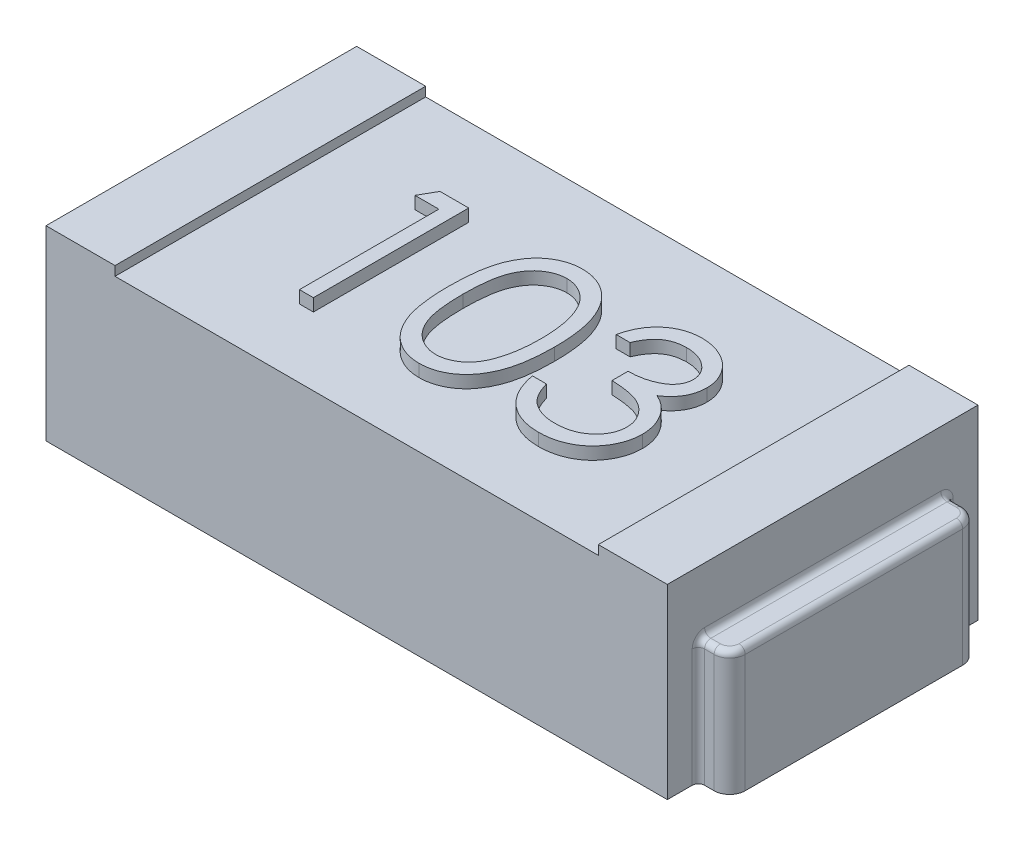
from build123d import *

# Parameters (mm, degrees)
ESQUISSE1_W             = 2
ESQUISSE1_H             = 1
BOSS_EXTRU_1_DEPTH      = 0.6
ESQUISSE2_W             = 1.555645222
ESQUISSE2_H             = 1
ENL_V_MAT_EXTRU_1_DEPTH = 0.03
BOSS_EXTRU_2_DEPTH      = 0.4
CONG_1_R                = 0.02
CONG_1_OF_SYM_TRIE2_R   = 0.02
BOSS_EXTRU_3_DEPTH      = 0.04


with BuildPart() as part:
    # Esquisse1 → Boss.-Extru.1 (new body)
    with BuildSketch(Plane(origin=(0, 0, 0), x_dir=(1, 0, 0), z_dir=(0, 1, 0))):
        Rectangle(ESQUISSE1_W, ESQUISSE1_H)
    extrude(amount=BOSS_EXTRU_1_DEPTH)

    # Esquisse2 → Enlèv. mat.-Extru.1 (cut)
    with BuildSketch(Plane(origin=(0, 0.6, 0), x_dir=(1, 0, 0), z_dir=(0, 1, 0))):
        Rectangle(ESQUISSE2_W, ESQUISSE2_H)
    extrude(amount=-ENL_V_MAT_EXTRU_1_DEPTH, mode=Mode.SUBTRACT)

    # Esquisse3 → Boss.-Extru.2 (add)
    with BuildSketch(Plane(origin=(0, 0, 0), x_dir=(1, 0, 0), z_dir=(0, 1, 0))):
        with BuildLine():
            Line((1, 0.4), (1.050552667, 0.4))
            ThreePointArc((1.050552667, 0.4), (1.085908006, 0.385355339), (1.100552667, 0.35))
            Line((1.100552667, 0.35), (1.100552667, -0.35))
            ThreePointArc((1.100552667, -0.35), (1.085908006, -0.385355339), (1.050552667, -0.4))
            Line((1.050552667, -0.4), (1, -0.4))
            Line((1, -0.4), (1, 0.4))
        make_face()
    boss_extru_2 = extrude(amount=BOSS_EXTRU_2_DEPTH)

    # Congé1
    cong_1_edges = [part.edges().sort_by_distance(p)[0] for p in [
        (1, 0.2, -0.4),
        (1, 0.2, 0.4),
        (1.025276334, 0.4, -0.4),
        (1.085908006, 0.4, -0.385355339),
        (1.100552667, 0.4, 0),
        (1.085908006, 0.4, 0.385355339),
        (1.025276334, 0.4, 0.4),
        (1, 0.4, 0),
    ]]
    fillet(cong_1_edges, radius=CONG_1_R)

    # Symétrie2: Boss.-Extru.2 across plane
    add(boss_extru_2.mirror(Plane(origin=(0, 0, 0), x_dir=(0, 0, 1), z_dir=(1, 0, 0))))

    # Congé1 of Symétrie2
    cong_1_of_sym_trie2_edges = [part.edges().sort_by_distance(p)[0] for p in [
        (-1, 0.2, -0.4),
        (-1, 0.2, 0.4),
        (-1.025276334, 0.4, -0.4),
        (-1.085908006, 0.4, -0.385355339),
        (-1.100552667, 0.4, 0),
        (-1.085908006, 0.4, 0.385355339),
        (-1.025276334, 0.4, 0.4),
        (-1, 0.4, 0),
    ]]
    fillet(cong_1_of_sym_trie2_edges, radius=CONG_1_OF_SYM_TRIE2_R)

    # Esquisse4 → Boss.-Extru.3 (add)
    # profile 1 of 3: a face of its own
    with BuildSketch(Plane(origin=(0, 0.57, 0), x_dir=(1, 0, 0), z_dir=(0, 1, 0))):
        with BuildLine():
            Line((0.275641026, 0.104315862), (0.230769231, 0.104315862))
            add(Edge.make_bspline(
                [(0.230769231, 0.104315862), (0.231984881, 0.109349074), (0.234361377, 0.119188592), (0.239318174, 0.133246772), (0.244718067, 0.146550132), (0.251202225, 0.158849571), (0.258274904, 0.170392272), (0.26637815, 0.180916432), (0.27513811, 0.190689713), (0.284827389, 0.199363033), (0.294988626, 0.207216994), (0.305765001, 0.213913431), (0.3169397, 0.219674024), (0.328590147, 0.224419771), (0.340751029, 0.227994846), (0.353312404, 0.230588676), (0.366307189, 0.23227312), (0.375128274, 0.232437515), (0.379607372, 0.23252099)],
                knots=[0, 0, 0, 0, 1.162005537, 2.271625781, 3.343758855, 4.383309926, 5.390229558, 6.379919256, 7.361854164, 8.333198761, 9.295911338, 10.242430842, 11.177959212, 12.116337295, 13.062827104, 14.020064771, 14.994644689, 16, 16, 16, 16], degree=3))
            add(Edge.make_bspline(
                [(0.379607372, 0.23252099), (0.386133478, 0.232323957), (0.399043337, 0.231934189), (0.418009486, 0.228374984), (0.436299032, 0.222742822), (0.453711781, 0.214960861), (0.469885843, 0.205362674), (0.484276727, 0.19393914), (0.496689371, 0.180910668), (0.507102854, 0.166520302), (0.515256425, 0.151140943), (0.521268764, 0.13531235), (0.524929004, 0.119072068), (0.52540337, 0.108106742), (0.525641026, 0.102613138)],
                knots=[0, 0, 0, 0, 1.083050992, 2.142477498, 3.193116406, 4.255571735, 5.30263384, 6.308962982, 7.297363603, 8.282367274, 9.249857812, 10.179914175, 11.08814088, 12, 12, 12, 12], degree=3))
            add(Edge.make_bspline(
                [(0.525641026, 0.102613138), (0.525474798, 0.097326453), (0.525149517, 0.086981231), (0.522387559, 0.07187816), (0.517739522, 0.057643645), (0.511300984, 0.044217765), (0.502966477, 0.031685645), (0.492870378, 0.020019089), (0.480941426, 0.009166352), (0.471901578, 0.002949285), (0.467247596, -0.000251446)],
                knots=[0, 0, 0, 0, 1.024540389, 2.004866551, 2.965041327, 3.920577974, 4.882998113, 5.874504559, 6.905732034, 8, 8, 8, 8], degree=3))
            add(Edge.make_bspline(
                [(0.467247596, -0.000251446), (0.472566418, -0.002819756), (0.483104543, -0.007908321), (0.497468904, -0.017887715), (0.510508601, -0.029410051), (0.517780561, -0.038401858), (0.521434295, -0.042919715)],
                knots=[0, 0, 0, 0, 1.015518401, 2.012035669, 3.001164323, 4, 4, 4, 4], degree=3))
            add(Edge.make_bspline(
                [(0.521434295, -0.042919715), (0.523840201, -0.046213679), (0.528612615, -0.052747668), (0.534503405, -0.063252871), (0.539847564, -0.073874513), (0.544011881, -0.084897285), (0.54723672, -0.09619343), (0.549541867, -0.107782343), (0.550973887, -0.119673489), (0.551178966, -0.127718129), (0.551282051, -0.131761862)],
                knots=[0, 0, 0, 0, 1.025084078, 2.033381695, 3.024893161, 4.013698104, 4.991890475, 5.976764909, 6.982997093, 8, 8, 8, 8], degree=3))
            add(Edge.make_bspline(
                [(0.551282051, -0.131761862), (0.551025692, -0.138763251), (0.55051418, -0.15273308), (0.54594217, -0.173372326), (0.538854564, -0.193547398), (0.528789287, -0.212843803), (0.516522501, -0.230898143), (0.501928597, -0.247051902), (0.485173396, -0.260937417), (0.466486875, -0.272538878), (0.446241571, -0.281812867), (0.424587915, -0.288249644), (0.401837907, -0.29244193), (0.386236864, -0.292891483), (0.378305288, -0.293120035)],
                knots=[0, 0, 0, 0, 0.955779014, 1.907060117, 2.875433937, 3.871313158, 4.872415639, 5.851225146, 6.836215519, 7.83643374, 8.849228613, 9.86973379, 10.916971861, 12, 12, 12, 12], degree=3))
            add(Edge.make_bspline(
                [(0.378305288, -0.293120035), (0.372959674, -0.292996005), (0.362441288, -0.292751954), (0.346977931, -0.291083583), (0.332217688, -0.288036439), (0.318140603, -0.283935967), (0.304734169, -0.278737147), (0.292039297, -0.272263047), (0.279977883, -0.264647118), (0.268663747, -0.255799463), (0.258098238, -0.245902128), (0.248562134, -0.234779413), (0.23989645, -0.222636926), (0.232333215, -0.209333633), (0.225527937, -0.195041453), (0.219930657, -0.179577382), (0.215004147, -0.163079664), (0.212713652, -0.151582844), (0.211538462, -0.145684138)],
                knots=[0, 0, 0, 0, 1.048658725, 2.063410685, 3.046034179, 4.001477787, 4.936774919, 5.862367409, 6.792675028, 7.730719943, 8.675894397, 9.627829632, 10.600096036, 11.597688215, 12.626045268, 13.701542398, 14.82072376, 16, 16, 16, 16], degree=3))
            Line((0.211538462, -0.145684138), (0.256410256, -0.145684138))
            add(Edge.make_bspline(
                [(0.256410256, -0.145684138), (0.257579298, -0.149533997), (0.259853186, -0.157022307), (0.2637238, -0.167799494), (0.268133553, -0.177679216), (0.272864204, -0.186733947), (0.277832553, -0.195052862), (0.283391828, -0.202415986), (0.289130278, -0.209146729), (0.2934559, -0.212938817), (0.295572917, -0.214794715)],
                knots=[0, 0, 0, 0, 1.198163088, 2.33053128, 3.407730985, 4.417276592, 5.372219308, 6.28897303, 7.162600585, 8, 8, 8, 8], degree=3))
            add(Edge.make_bspline(
                [(0.295572917, -0.214794715), (0.298372428, -0.216953048), (0.303962808, -0.221263053), (0.313072555, -0.226763286), (0.322653253, -0.231529146), (0.332912492, -0.235169674), (0.343628888, -0.238252197), (0.354975655, -0.240269414), (0.366852686, -0.241653439), (0.374962366, -0.241775572), (0.379106571, -0.241837984)],
                knots=[0, 0, 0, 0, 0.946170439, 1.889420265, 2.845303464, 3.807233317, 4.801018734, 5.828864929, 6.890507805, 8, 8, 8, 8], degree=3))
            add(Edge.make_bspline(
                [(0.379106571, -0.241837984), (0.383785642, -0.241749998), (0.392935163, -0.241577948), (0.406285857, -0.239995704), (0.418986921, -0.237691359), (0.430897339, -0.234132362), (0.442173126, -0.229735097), (0.452656219, -0.224213896), (0.462484234, -0.217736079), (0.471531292, -0.210373342), (0.479666365, -0.202313128), (0.486829152, -0.19388269), (0.49291839, -0.185117571), (0.497830329, -0.175969268), (0.501708979, -0.166475664), (0.504349437, -0.156610117), (0.506185367, -0.146453365), (0.506334883, -0.139549226), (0.506410256, -0.136068753)],
                knots=[0, 0, 0, 0, 1.217147791, 2.380027433, 3.494444702, 4.572153297, 5.609568379, 6.639424714, 7.649109417, 8.668170816, 9.669597737, 10.625200337, 11.543417969, 12.441394052, 13.322311151, 14.205496177, 15.095365482, 16, 16, 16, 16], degree=3))
            add(Edge.make_bspline(
                [(0.506410256, -0.136068753), (0.506191642, -0.131409991), (0.505755501, -0.122115647), (0.502425704, -0.108441707), (0.496948723, -0.095266934), (0.489281221, -0.082816107), (0.479947546, -0.071276693), (0.469038273, -0.060980767), (0.456462812, -0.052485039), (0.444888545, -0.046615231), (0.43463638, -0.042609935), (0.425862754, -0.039942083), (0.416040382, -0.037682989), (0.405288046, -0.035581236), (0.39352473, -0.033792472), (0.380763238, -0.032300784), (0.367000987, -0.031107207), (0.357473677, -0.030574193), (0.352564103, -0.030299523)],
                knots=[0, 0, 0, 0, 1.07054697, 2.135767047, 3.216561865, 4.33974944, 5.486079747, 6.621378074, 7.775625952, 8.963672916, 9.598146892, 10.304877434, 11.070270905, 11.915000392, 12.823868403, 13.805723172, 14.86925407, 16, 16, 16, 16], degree=3))
            Line((0.352564103, -0.030299523), (0.352564103, 0.020982529))
            add(Edge.make_bspline(
                [(0.352564103, 0.020982529), (0.358749983, 0.021087501), (0.370866604, 0.021293115), (0.388565791, 0.023779974), (0.40549055, 0.027220063), (0.421265798, 0.032489376), (0.435644186, 0.038609419), (0.448118415, 0.045731163), (0.458513722, 0.053647556), (0.466779589, 0.062480786), (0.47299805, 0.071954364), (0.477544736, 0.081828172), (0.480230497, 0.092188752), (0.48058902, 0.099259419), (0.480769231, 0.102813458)],
                knots=[0, 0, 0, 0, 1.321986639, 2.589447074, 3.816329219, 5.01088745, 6.139805852, 7.153945165, 8.075214402, 8.924034688, 9.728124013, 10.488707548, 11.240355623, 12, 12, 12, 12], degree=3))
            add(Edge.make_bspline(
                [(0.480769231, 0.102813458), (0.480710029, 0.105424565), (0.48059225, 0.110619237), (0.479106925, 0.118208533), (0.476874919, 0.125565811), (0.473806386, 0.132659783), (0.469699215, 0.139441251), (0.464784074, 0.14596803), (0.458931489, 0.152202855), (0.452224996, 0.158014329), (0.44502331, 0.163552792), (0.437130485, 0.16825474), (0.428784503, 0.172275463), (0.419976123, 0.175591106), (0.410676762, 0.17808529), (0.400930111, 0.179876125), (0.390717585, 0.18099579), (0.383750194, 0.181156992), (0.380208333, 0.181238939)],
                knots=[0, 0, 0, 0, 0.884392785, 1.759457502, 2.611959086, 3.489218968, 4.37281399, 5.2945488, 6.255912374, 7.266815255, 8.301784654, 9.332968512, 10.37626691, 11.440494194, 12.520033166, 13.637162961, 14.798855837, 16, 16, 16, 16], degree=3))
            add(Edge.make_bspline(
                [(0.380208333, 0.181238939), (0.374515238, 0.181040173), (0.363395298, 0.180651937), (0.347364596, 0.177251506), (0.332461834, 0.171826066), (0.321070596, 0.16534992), (0.3126588, 0.158957001), (0.306647808, 0.153373803), (0.300744878, 0.147169114), (0.295338353, 0.139960774), (0.289870642, 0.132236947), (0.284892848, 0.123604993), (0.280055749, 0.114290079), (0.277141099, 0.107704989), (0.275641026, 0.104315862)],
                knots=[0, 0, 0, 0, 1.472543308, 2.876219568, 4.221790263, 5.565193594, 6.249813518, 6.953379497, 7.687249741, 8.463570142, 9.283606569, 10.136032583, 11.040678096, 12, 12, 12, 12], degree=3))
        make_face()
    # profile 2 of 3: a face of its own
    with BuildSketch(Plane(origin=(0, 0.57, 0), x_dir=(1, 0, 0), z_dir=(0, 1, 0))):
        with BuildLine():
            add(Edge.make_bspline(
                [(-0.173076923, -0.030499843), (-0.173030063, -0.022485931), (-0.172939038, -0.00691879), (-0.171926406, 0.01576473), (-0.170244214, 0.037044772), (-0.167938875, 0.056922352), (-0.16513345, 0.075402605), (-0.16138838, 0.092436141), (-0.157129408, 0.108101799), (-0.152193345, 0.122450663), (-0.14662366, 0.13567605), (-0.140561623, 0.148022507), (-0.133766653, 0.159471354), (-0.126627094, 0.170205324), (-0.11885394, 0.180048709), (-0.110668399, 0.189140518), (-0.101750988, 0.197270626), (-0.092404844, 0.20467724), (-0.082545349, 0.211170022), (-0.07245354, 0.216888984), (-0.062059953, 0.22177468), (-0.051336213, 0.225616171), (-0.040378704, 0.228789149), (-0.029149123, 0.230958998), (-0.017628929, 0.232324271), (-0.009853009, 0.232454795), (-0.005909455, 0.23252099)],
                knots=[0, 0, 0, 0, 1.646270934, 3.197905019, 4.663502075, 6.030701355, 7.308322542, 8.50163776, 9.611534131, 10.641858119, 11.616356847, 12.558055219, 13.465016945, 14.349605745, 15.204443733, 16.039544428, 16.859896111, 17.680448484, 18.487036065, 19.28249412, 20.06191084, 20.843045899, 21.620316918, 22.403196591, 23.190181807, 24, 24, 24, 24], degree=3))
            add(Edge.make_bspline(
                [(-0.005909455, 0.23252099), (-0.001932958, 0.232451302), (0.005975043, 0.232312715), (0.017666525, 0.230980723), (0.029087908, 0.228770563), (0.0401905, 0.225638995), (0.051065498, 0.221753898), (0.061627842, 0.21688431), (0.071943139, 0.211215901), (0.081847466, 0.204555347), (0.091449554, 0.197129307), (0.100513548, 0.18873464), (0.109040275, 0.179456109), (0.117136747, 0.169392986), (0.124573261, 0.158352259), (0.13165518, 0.146525958), (0.137994042, 0.133707263), (0.144098996, 0.120110053), (0.149368565, 0.105358102), (0.154120886, 0.089534565), (0.157960739, 0.072452538), (0.161159206, 0.054201646), (0.163637048, 0.034714862), (0.165441712, 0.01403396), (0.16639501, -0.007854667), (0.166574538, -0.022820074), (0.166666667, -0.030499843)],
                knots=[0, 0, 0, 0, 0.810914788, 1.612654377, 2.396697861, 3.181598691, 3.963628158, 4.749916497, 5.551656086, 6.361998678, 7.18212741, 8.025565596, 8.878627764, 9.750805457, 10.657531673, 11.591944965, 12.560506719, 13.57287815, 14.630710178, 15.753379473, 16.941251878, 18.199788006, 19.531962791, 20.947069417, 22.433333509, 24, 24, 24, 24], degree=3))
            add(Edge.make_bspline(
                [(0.166666667, -0.030499843), (0.166573583, -0.038146116), (0.166392214, -0.053044566), (0.165452398, -0.074834705), (0.163601165, -0.095405854), (0.161285453, -0.114807349), (0.158078172, -0.132958437), (0.154134577, -0.14992193), (0.14975596, -0.165771083), (0.144350989, -0.180376056), (0.138435173, -0.193940588), (0.131998717, -0.206607324), (0.125103027, -0.218488222), (0.117590349, -0.229488186), (0.109582719, -0.239685137), (0.100908749, -0.248899083), (0.091812951, -0.257352037), (0.082182606, -0.264873698), (0.072123813, -0.271457241), (0.061843945, -0.277344934), (0.051160605, -0.282092462), (0.040315897, -0.286168896), (0.029154702, -0.289283247), (0.017690932, -0.291436655), (0.005982898, -0.292946919), (-0.001931611, -0.29306213), (-0.005909455, -0.293120035)],
                knots=[0, 0, 0, 0, 1.561518951, 3.042555995, 4.452378317, 5.7783523, 7.031515105, 8.214008947, 9.334062868, 10.386615937, 11.391082383, 12.354592575, 13.286541444, 14.194233754, 15.072674879, 15.931287219, 16.775624067, 17.606195743, 18.42308326, 19.229000347, 20.022332153, 20.807536673, 21.593273796, 22.3848459, 23.188221202, 24, 24, 24, 24], degree=3))
            add(Edge.make_bspline(
                [(-0.005909455, -0.293120035), (-0.0098529, -0.293053413), (-0.017628604, -0.292922047), (-0.029150379, -0.291562943), (-0.040333585, -0.289377871), (-0.051233407, -0.286318356), (-0.061905766, -0.282573379), (-0.072205236, -0.277694282), (-0.082246333, -0.272075129), (-0.09200227, -0.265675783), (-0.101289721, -0.258344114), (-0.110160951, -0.25023493), (-0.118393096, -0.241145871), (-0.12605511, -0.231220454), (-0.133337123, -0.22054999), (-0.140035605, -0.208988794), (-0.146231441, -0.196582707), (-0.151894797, -0.183251577), (-0.156916034, -0.168800873), (-0.161351421, -0.153065276), (-0.164853444, -0.135905899), (-0.167851009, -0.117460561), (-0.170268778, -0.09765), (-0.171919396, -0.07646346), (-0.172939583, -0.053914145), (-0.173030308, -0.038447034), (-0.173076923, -0.030499843)],
                knots=[0, 0, 0, 0, 0.810891512, 1.598919785, 2.382837074, 3.152667961, 3.926044502, 4.706494248, 5.493654104, 6.291793342, 7.103789334, 7.925228297, 8.761435821, 9.622817696, 10.50288917, 11.416980706, 12.369136599, 13.353924996, 14.394355917, 15.514179734, 16.714354668, 17.994756427, 19.357759367, 20.818452758, 22.365282078, 24, 24, 24, 24], degree=3))
        make_face()
        with BuildLine():
            add(Edge.make_bspline(
                [(-0.128205128, -0.030299523), (-0.128188064, -0.036977908), (-0.128154947, -0.049939343), (-0.127289775, -0.068774095), (-0.126111171, -0.086341285), (-0.124590985, -0.102663218), (-0.122333421, -0.117684649), (-0.11980388, -0.131508889), (-0.116725582, -0.14406278), (-0.113083436, -0.155432467), (-0.108934994, -0.165810906), (-0.104405585, -0.175468222), (-0.099539767, -0.184518499), (-0.094094174, -0.192880443), (-0.088163451, -0.200581323), (-0.081881557, -0.207757442), (-0.075014045, -0.214157011), (-0.06551351, -0.221832276), (-0.052971157, -0.229763581), (-0.037168234, -0.236670165), (-0.020929884, -0.241010516), (-0.009908277, -0.241562481), (-0.004407051, -0.241837984)],
                knots=[0, 0, 0, 0, 1.459021318, 2.831673884, 4.118529203, 5.306027144, 6.411944654, 7.436330062, 8.375795394, 9.233974572, 10.042671642, 10.816086306, 11.563610507, 12.285937304, 12.993564865, 13.685989202, 14.367179055, 15.041617293, 16.353048772, 17.594441528, 18.799311195, 20, 20, 20, 20], degree=3))
            add(Edge.make_bspline(
                [(-0.004407051, -0.241837984), (0.001129759, -0.24160973), (0.012191948, -0.241153692), (0.028353919, -0.236753873), (0.044043957, -0.230115367), (0.056339949, -0.222265723), (0.065694598, -0.214790248), (0.072397025, -0.208416726), (0.078548746, -0.201280174), (0.084383328, -0.193580275), (0.089734625, -0.18516992), (0.094600787, -0.176089552), (0.099041266, -0.166313955), (0.101571129, -0.159489707), (0.102864583, -0.156000644)],
                knots=[0, 0, 0, 0, 1.353760809, 2.704726607, 4.075137775, 5.516104923, 6.260822281, 7.007110065, 7.778089737, 8.566572457, 9.372053459, 10.217411131, 11.088608312, 12, 12, 12, 12], degree=3))
            add(Edge.make_bspline(
                [(0.102864583, -0.156000644), (0.104371979, -0.151539253), (0.107432638, -0.142480715), (0.111377177, -0.128428765), (0.114483663, -0.113685513), (0.117278429, -0.098339068), (0.119186009, -0.082276253), (0.12072141, -0.06554677), (0.121625794, -0.048138004), (0.121737902, -0.036310148), (0.121794872, -0.030299523)],
                knots=[0, 0, 0, 0, 0.884706709, 1.796334032, 2.740027952, 3.714592787, 4.726048262, 5.777819803, 6.87074269, 8, 8, 8, 8], degree=3))
            add(Edge.make_bspline(
                [(0.121794872, -0.030299523), (0.121716273, -0.024289869), (0.121562518, -0.012533703), (0.120974805, 0.00468318), (0.119457152, 0.021035717), (0.117771564, 0.036594356), (0.115286246, 0.051272971), (0.11260656, 0.065194443), (0.109006386, 0.078186304), (0.105160704, 0.090451958), (0.100759219, 0.101852052), (0.095914114, 0.112439736), (0.090739577, 0.122266125), (0.085119257, 0.131304259), (0.079119874, 0.139594623), (0.072583081, 0.146970993), (0.065768171, 0.153661989), (0.056222858, 0.161299499), (0.043726531, 0.169086884), (0.028177153, 0.176253421), (0.011995633, 0.180368891), (0.001056568, 0.180949132), (-0.004407051, 0.181238939)],
                knots=[0, 0, 0, 0, 1.31362396, 2.569729283, 3.763502607, 4.902122613, 5.988968491, 7.01645872, 7.998833611, 8.933434873, 9.825090667, 10.667526885, 11.477055099, 12.250526234, 12.991942729, 13.710640831, 14.402115721, 15.076753259, 16.378508321, 17.609869233, 18.806226677, 20, 20, 20, 20], degree=3))
            add(Edge.make_bspline(
                [(-0.004407051, 0.181238939), (-0.009937136, 0.180948732), (-0.02100738, 0.18036779), (-0.037357087, 0.176268754), (-0.053029138, 0.169124045), (-0.06549242, 0.161273706), (-0.075044389, 0.153796804), (-0.081770488, 0.147313025), (-0.088077084, 0.140220703), (-0.093886756, 0.132449001), (-0.099328082, 0.124096805), (-0.104325369, 0.11509841), (-0.108827845, 0.105408216), (-0.112982779, 0.095034439), (-0.116636034, 0.083665733), (-0.119649458, 0.071127305), (-0.122433322, 0.057347035), (-0.124404075, 0.042244248), (-0.12615604, 0.025918226), (-0.127281947, 0.008307181), (-0.128157841, -0.01055916), (-0.12818905, -0.023587611), (-0.128205128, -0.030299523)],
                knots=[0, 0, 0, 0, 1.207732386, 2.417664972, 3.655092373, 4.956220595, 5.625982001, 6.301752483, 6.994047911, 7.697131622, 8.419323945, 9.170223765, 9.943494443, 10.752040957, 11.610060368, 12.549350801, 13.567764191, 14.679664412, 15.874934091, 17.154273443, 18.533957287, 20, 20, 20, 20], degree=3))
        make_face(mode=Mode.SUBTRACT)
    # profile 3 of 3: a face of its own
    with BuildSketch(Plane(origin=(0, 0.57, 0), x_dir=(1, 0, 0), z_dir=(0, 1, 0))):
        Polygon((-0.451422276, 0.219700477), (-0.358974359, 0.219700477), (-0.358974359, -0.280299523), (-0.403846154, -0.280299523), (-0.403846154, 0.168418426), (-0.480769231, 0.168418426), align=None)
    extrude(amount=BOSS_EXTRU_3_DEPTH)


solid = part.part
